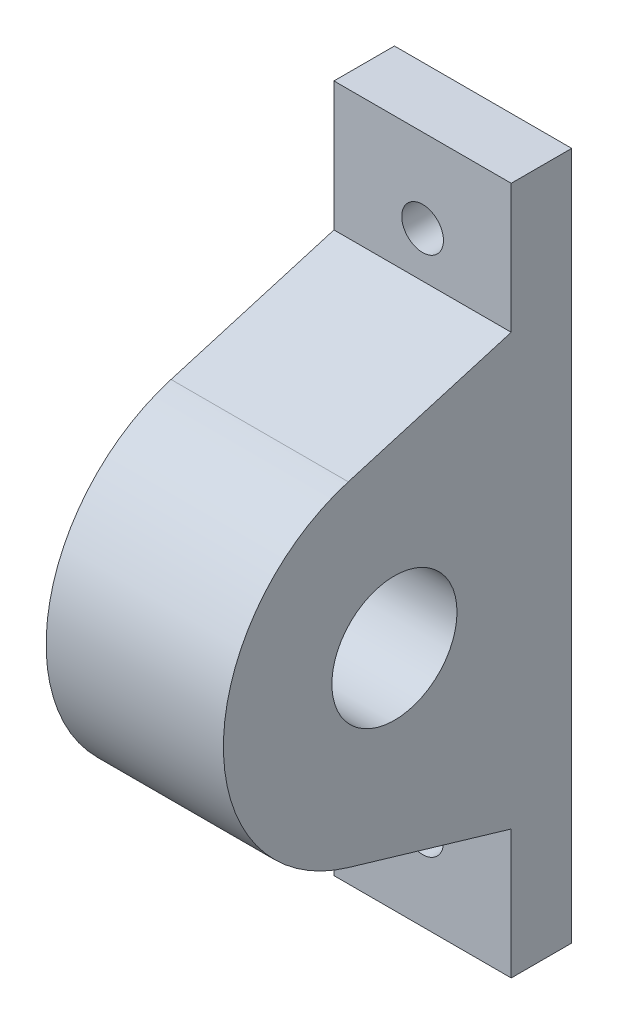
from build123d import *

# Parameters (mm, degrees)
SKETCH1_R           = 30
BOSS_EXTRUDE1_DEPTH = 85
SKETCH2_R           = 10
CUT_EXTRUDE1_DEPTH  = 85


with BuildPart() as part:
    # Sketch1 → Boss-Extrude1 (new body)
    with BuildSketch(Plane.YZ):
        with BuildLine():
            Line((-165, -83.5), (165, -83.5))
            Line((165, -83.5), (165, -54.5))
            Line((165, -54.5), (103.12562301, -54.5))
            Line((103.12562301, -54.5), (80.090474911, 23.617066466))
            ThreePointArc((80.090474911, 23.617066466), (0, 83.5), (-80.090474911, 23.617066466))
            Line((-80.090474911, 23.617066466), (-103.12562301, -54.5))
            Line((-103.12562301, -54.5), (-165, -54.5))
            Line((-165, -54.5), (-165, -83.5))
        make_face()
        with Locations((0, 1.5)):
            Circle(SKETCH1_R, mode=Mode.SUBTRACT)
    extrude(amount=BOSS_EXTRUDE1_DEPTH)

    # Sketch2 → Cut-Extrude1 (cut)
    with BuildSketch(Plane.XY.offset(-54.5)):
        with Locations((42.5, 125)):
            Circle(SKETCH2_R)
        with Locations((42.5, -125)):
            Circle(SKETCH2_R)
    extrude(amount=-CUT_EXTRUDE1_DEPTH, mode=Mode.SUBTRACT)


solid = part.part
